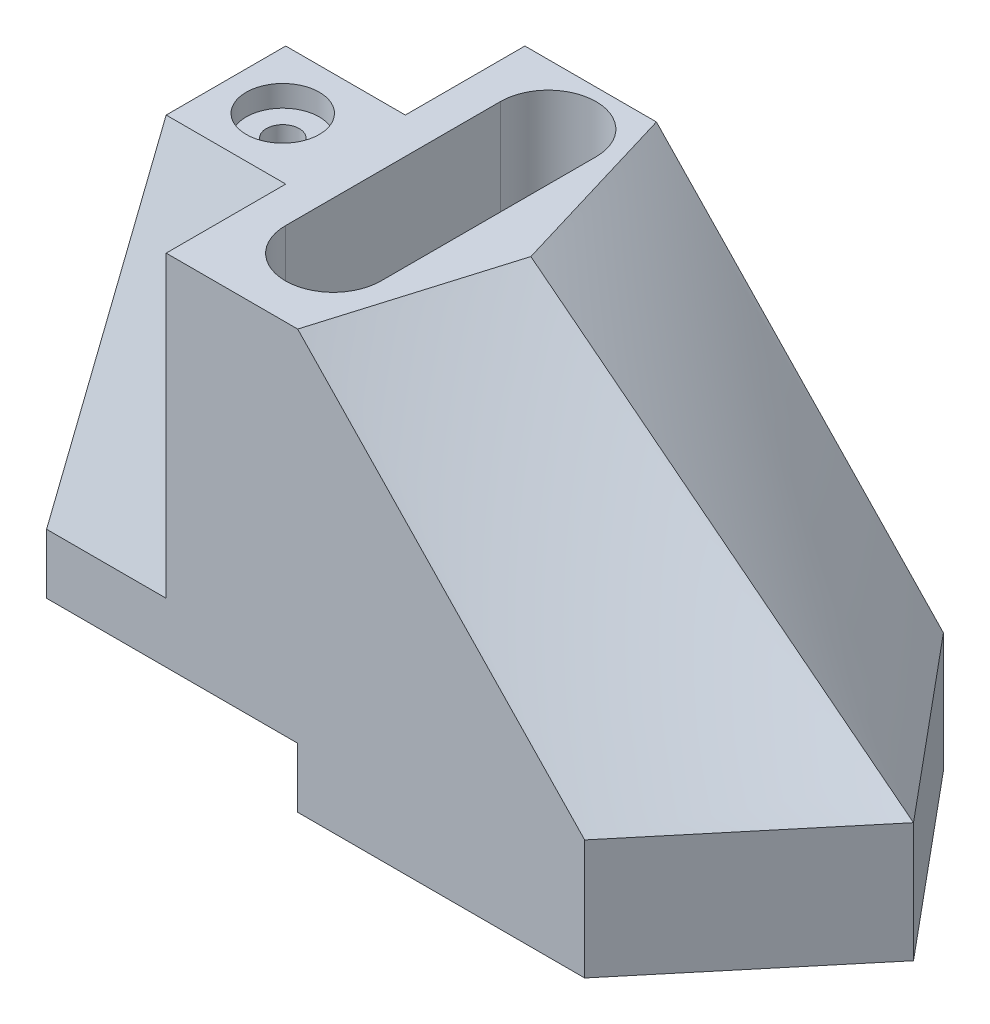
from build123d import *

# Parameters (mm, degrees)
BOSS_EXTRUDE2_REACH                                  = 123.758
SKETCH4_119_W                                        = 22
SKETCH4_119_H                                        = 60
BOSS_EXTRUDE3_DEPTH                                  = 50
CUT_EXTRUDE1_DEPTH                                   = 20
CUT_EXTRUDE2_DEPTH                                   = 50
CUT_EXTRUDE3_START                                   = -10
SKETCH4_121_W                                        = 20
SKETCH4_121_H                                        = 60
SKETCH4_121_W_2                                      = 22
CUT_EXTRUDE3_DEPTH                                   = 10
CBORE_FOR_5_16_BINDING_HEAD_MACHINE_SCRE_D           = 5.499999922
CBORE_FOR_5_16_BINDING_HEAD_MACHINE_SCRE_DEPTH       = 30
CBORE_FOR_5_16_BINDING_HEAD_MACHINE_SCRE_CBORE_D     = 12.239999904
CBORE_FOR_5_16_BINDING_HEAD_MACHINE_SCRE_CBORE_DEPTH = 3.579999952
CBORE_FOR_5_16_BINDING_HEAD_MACHINE_SCRE_TIP         = 1.652366679


with BuildPart() as part:
    # Loft3: read off the stored shape, not the designer's step
    # Loft3: loft between two sections, ruled curve by curve
    loft3_from = [
        Edge.make_bspline([(-25, 20, 30), (0, 20, 0)], [0, 0, 1, 1], 1),
        Edge.make_bspline([(0, 20, 0), (-25, 20, -30)], [0, 0, 1, 1], 1),
        Edge.make_line((-73, 20, 30), (-25, 20, 30)),
        Edge.make_line((-25, 20, -30), (-73, 20, -30)),
        Edge.make_line((-73, 20, -30), (-73, 20, 30)),
    ]
    loft3_to = [
        Edge.make_bspline([(-73, 70, 30), (-64, 70, 0)], [0, 0, 1, 1], 1),
        Edge.make_bspline([(-64, 70, 0), (-73, 70, -30)], [0, 0, 1, 1], 1),
        Edge.make_line((-95, 70, 30), (-73, 70, 30)),
        Edge.make_line((-73, 70, -30), (-95, 70, -30)),
        Edge.make_line((-95, 70, -30), (-95, 70, 30)),
    ]
    loft3 = Solid(Shell([*[Face.make_surface_from_curves(loft3_from[k], loft3_to[k]) for k in range(5)], Face(Wire(loft3_from)), Face(Wire(loft3_to))]))
    add(loft3)

    # Boss-Extrude2: up to this face of the body (flat: up to its plane)
    boss_extrude2_end = Plane(part.part.faces().sort_by_distance((-42.319559229, 20, 0))[0])
    # Sketch1 → Boss-Extrude2 (add, up to the picked face)
    with BuildSketch(Plane(origin=(0, 0, 0), x_dir=(1, 0, 0), z_dir=(0, 1, 0)), mode=Mode.PRIVATE) as boss_extrude2_sk1:
        Polygon((-115, -30), (-115, 30), (-25, 30), (0, 0), (-25, -30), align=None)
    boss_extrude2_tool1 = split(extrude(boss_extrude2_sk1.sketch, amount=BOSS_EXTRUDE2_REACH, mode=Mode.PRIVATE), bisect_by=boss_extrude2_end, keep=Keep.BOTH, mode=Mode.PRIVATE)
    add(boss_extrude2_tool1.solids().sort_by(Axis((-63.495935, 0, 0), (0, 1, 0)))[0])

    # Sketch4 → Loft7 section 0
    with BuildSketch(Plane(origin=(0, 20, 0), x_dir=(1, 0, 0), z_dir=(0, 1, 0))):
        with BuildLine():
            Line((-73, -30), (-73, 30))
            Line((-73, 30), (-95, 30))
            Line((-95, 30), (-95, -30))
            Line((-95, -30), (-73, -30))
        make_face()
    # Sketch2<11> → Loft7 section 1
    with BuildSketch(Plane(origin=(0, 70, 0), x_dir=(1, 0, 0), z_dir=(0, 1, 0))):
        with BuildLine():
            Line((-115, 10), (-115, -10))
            Line((-115, -10), (-95, -10))
            Line((-95, -10), (-95, 10))
            Line((-95, 10), (-115, 10))
        make_face()
    loft()

    # Sketch2<14> → section 1 of loft9
    with BuildSketch(Plane(origin=(0, 70, 0), x_dir=(1, 0, 0), z_dir=(0, 1, 0)), mode=Mode.PRIVATE) as loft9_s1:
        with BuildLine():
            Line((-115, 10), (-115, -10))
            Line((-115, -10), (-95, -10))
            Line((-95, -10), (-95, 10))
            Line((-95, 10), (-115, 10))
        make_face()
    # loft from a face of the part (loft9)
    loft([part.faces().sort_by_distance((-105, 20, 0))[0], loft9_s1.sketch])

    # Sketch4<119> → Boss-Extrude3 (add)
    with BuildSketch(Plane(origin=(0, 20, 0), x_dir=(1, 0, 0), z_dir=(0, 1, 0))):
        with Locations((-84, 0)):
            Rectangle(SKETCH4_119_W, SKETCH4_119_H)
    extrude(amount=BOSS_EXTRUDE3_DEPTH)

    # Sketch2<8> → Cut-Extrude1 (cut)
    with BuildSketch(Plane(origin=(0, 70, 0), x_dir=(1, 0, 0), z_dir=(0, 1, 0))):
        with BuildLine():
            Line((-89, 19.903363007), (-89, -16.052534228))
            ThreePointArc((-89, -16.052534228), (-81, -24.052534228), (-73, -16.052534228))
            Line((-73, -16.052534228), (-73, 19.903363007))
            ThreePointArc((-73, 19.903363007), (-81, 27.903363007), (-89, 19.903363007))
        make_face()
        with BuildLine():
            ThreePointArc((-78, 19.903363007), (-81, 22.903363007), (-84, 19.903363007))
            Line((-84, 19.903363007), (-84, -16.052534228))
            ThreePointArc((-84, -16.052534228), (-81, -19.052534228), (-78, -16.052534228))
            Line((-78, -16.052534228), (-78, 19.903363007))
        make_face(mode=Mode.SUBTRACT)
    extrude(amount=-CUT_EXTRUDE1_DEPTH, mode=Mode.SUBTRACT)

    # Sketch2<13> → Cut-Extrude2 (cut)
    with BuildSketch(Plane(origin=(0, 70, 0), x_dir=(1, 0, 0), z_dir=(0, 1, 0))):
        with BuildLine():
            Line((-78, -16.052534228), (-78, 19.903363007))
            ThreePointArc((-78, 19.903363007), (-81, 22.903363007), (-84, 19.903363007))
            Line((-84, 19.903363007), (-84, -16.052534228))
            ThreePointArc((-84, -16.052534228), (-81, -19.052534228), (-78, -16.052534228))
        make_face()
    extrude(amount=-CUT_EXTRUDE2_DEPTH, mode=Mode.SUBTRACT)

    # Sketch4<121> → Cut-Extrude3 (cut)
    with BuildSketch(Plane(origin=(0, 20, 0), x_dir=(1, 0, 0), z_dir=(0, 1, 0)).offset(CUT_EXTRUDE3_START)):
        with Locations((-105, 0)):
            Rectangle(SKETCH4_121_W, SKETCH4_121_H)
        with Locations((-84, 0)):
            Rectangle(SKETCH4_121_W_2, SKETCH4_121_H)
    extrude(amount=-CUT_EXTRUDE3_DEPTH, mode=Mode.SUBTRACT)

    # CBORE for 5/16 Binding Head Machine Screw1
    with Locations(Plane(origin=(0, 70, 0), x_dir=(1, 0, 0), z_dir=(0, 1, 0))):
        with Locations((-105.496950166, 0)):
            CounterBoreHole(CBORE_FOR_5_16_BINDING_HEAD_MACHINE_SCRE_D / 2, CBORE_FOR_5_16_BINDING_HEAD_MACHINE_SCRE_CBORE_D / 2, CBORE_FOR_5_16_BINDING_HEAD_MACHINE_SCRE_CBORE_DEPTH, depth=CBORE_FOR_5_16_BINDING_HEAD_MACHINE_SCRE_DEPTH)
            with Locations((0, 0, -(CBORE_FOR_5_16_BINDING_HEAD_MACHINE_SCRE_DEPTH + CBORE_FOR_5_16_BINDING_HEAD_MACHINE_SCRE_TIP / 2))):  # 118° drill point
                Cone(0, CBORE_FOR_5_16_BINDING_HEAD_MACHINE_SCRE_D / 2, CBORE_FOR_5_16_BINDING_HEAD_MACHINE_SCRE_TIP, mode=Mode.SUBTRACT)


solid = part.part
